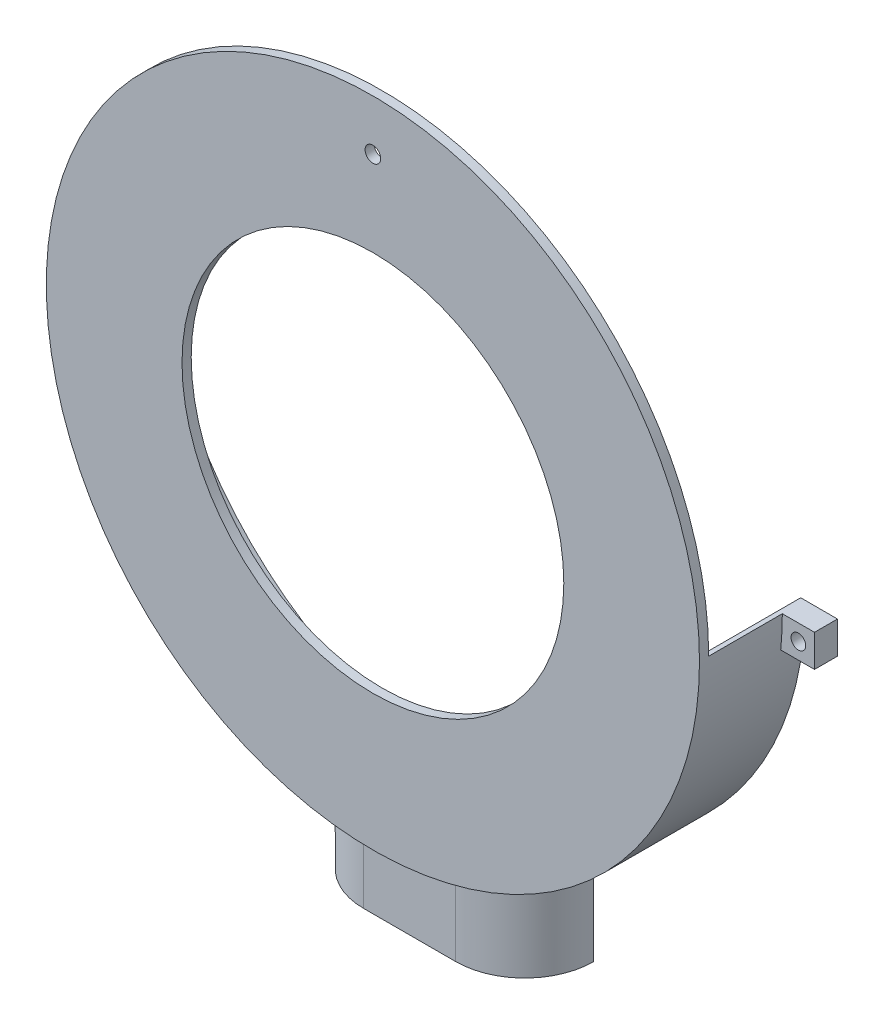
from build123d import *

# Parameters (mm, degrees)
BOSS_EXTRUDE1_DEPTH = 21
SKETCH2_R           = 71
SKETCH2_R_2         = 41.5
BOSS_EXTRUDE2_DEPTH = 2
SKETCH3_W           = 50
SKETCH3_H           = 20
BOSS_EXTRUDE3_DEPTH = 15
SKETCH8_R           = 1.6
BOSS_EXTRUDE5_DEPTH = 5
FILLET2_R           = 15
SKETCH11_W          = 43.237900078
SKETCH11_H          = 3
CUT_EXTRUDE7_DEPTH  = 20
SKETCH12_R          = 1.7
CUT_EXTRUDE8_DEPTH  = 10


with BuildPart() as part:
    # Sketch1 → Boss-Extrude1 (new body)
    with BuildSketch(Plane.XY):
        with BuildLine():
            Line((71, 0), (70, 0))
            ThreePointArc((70, 0), (0, -70), (-70, 0))
            Line((-70, 0), (-71, 0))
            ThreePointArc((-71, 0), (0, -71), (71, 0))
        make_face()
    extrude(amount=BOSS_EXTRUDE1_DEPTH)

    # Sketch2 → Boss-Extrude2 (add)
    with BuildSketch(Plane.XY.offset(21)):
        Circle(SKETCH2_R)
        Circle(SKETCH2_R_2, mode=Mode.SUBTRACT)
    extrude(amount=BOSS_EXTRUDE2_DEPTH)

    # Sketch3 → Boss-Extrude3 (add)
    with BuildSketch(Plane(origin=(0, 0, 0), x_dir=(-1, 0, 0), z_dir=(0, 0, -1))):
        with BuildLine():
            Line((-25, -66.452990903), (-25, -71))
            Line((-25, -71), (0, -71))
            ThreePointArc((0, -71), (-12.705070757, -69.853999006), (-25, -66.452990903))
        make_face()
        with BuildLine():
            ThreePointArc((25, -66.452990903), (12.705070757, -69.853999006), (0, -71))
            Line((0, -71), (25, -71))
            Line((25, -71), (25, -66.452990903))
        make_face()
        with Locations((0, -81)):
            Rectangle(SKETCH3_W, SKETCH3_H)
    extrude(amount=-BOSS_EXTRUDE3_DEPTH)

    # Sketch8 → Boss-Extrude5 (add)
    # profile 1 of 2: a face of its own
    with BuildSketch(Plane(origin=(0, 0, 0), x_dir=(-1, 0, 0), z_dir=(0, 0, -1))):
        with BuildLine():
            ThreePointArc((-70.654086931, -7), (-70.913469003, -3.504270818), (-71, 0))
            Line((-71, 0), (-78, 0))
            Line((-78, 0), (-78, -7))
            Line((-78, -7), (-70.654086931, -7))
        make_face()
        with Locations((-74.5, -3.5)):
            Circle(SKETCH8_R, mode=Mode.SUBTRACT)
    # profile 2 of 2: a face of its own
    with BuildSketch(Plane(origin=(0, 0, 0), x_dir=(-1, 0, 0), z_dir=(0, 0, -1))):
        with BuildLine():
            Line((78, 0), (71, 0))
            ThreePointArc((71, 0), (70.913469003, -3.504270818), (70.654086931, -7))
            Line((70.654086931, -7), (78, -7))
            Line((78, -7), (78, 0))
        make_face()
        with Locations(Location((74.5, -3.5, 0), (0, 0, 180))):
            Circle(SKETCH8_R, mode=Mode.SUBTRACT)
    extrude(amount=-BOSS_EXTRUDE5_DEPTH)

    # Fillet2
    fillet2_edges = [part.edges().sort_by_distance(p)[0] for p in [
        (-25, -78.726495452, 15),
        (25, -78.726495452, 15),
    ]]
    fillet(fillet2_edges, radius=FILLET2_R - 0.0001)  # a hair under: the kernel refuses the full size

    # Sketch11 → Cut-Extrude7 (cut)
    with BuildSketch(Plane.XZ.offset(91)):
        with Locations((0, 1.5)):
            Rectangle(SKETCH11_W, SKETCH11_H)
        with BuildLine():
            Line((-21.618950039, 3), (21.618950039, 3))
            ThreePointArc((21.618950039, 3), (17.348469228, 9.486832981), (10, 12))
            Line((10, 12), (-10, 12))
            ThreePointArc((-10, 12), (-17.348469228, 9.486832981), (-21.618950039, 3))
        make_face()
    extrude(amount=-CUT_EXTRUDE7_DEPTH, mode=Mode.SUBTRACT)

    # Sketch12 → Cut-Extrude8 (cut)
    with BuildSketch(Plane.XY.offset(23)):
        with Locations((0, 60)):
            Circle(SKETCH12_R)
    extrude(amount=-CUT_EXTRUDE8_DEPTH, mode=Mode.SUBTRACT)


solid = part.part
